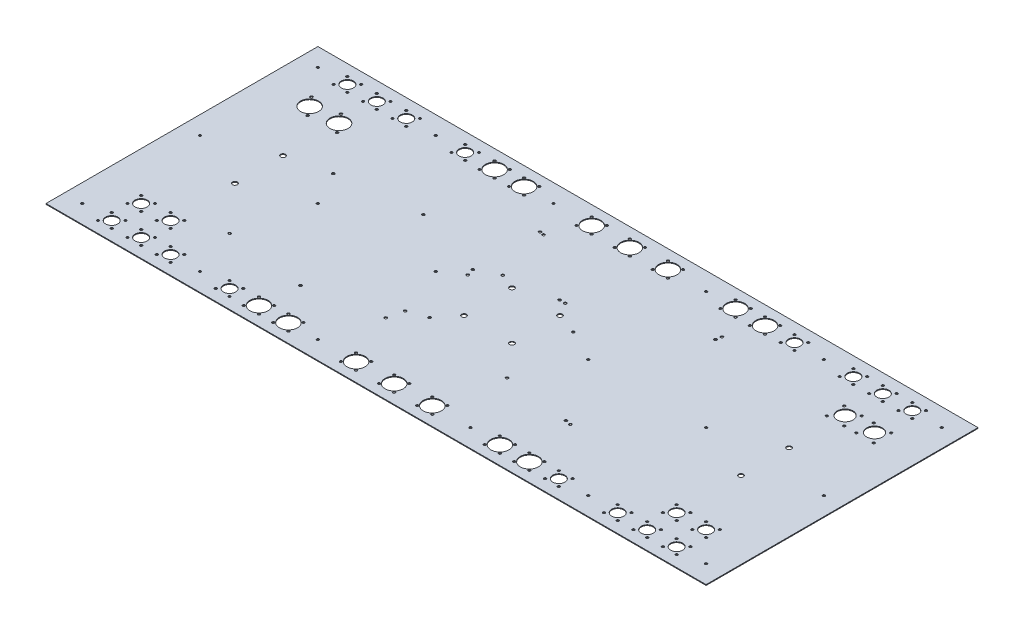
from build123d import *

# Parameters (mm, degrees)
MAIN_PLATE_W        = 874
MAIN_PLATE_H        = 360
BOSS_EXTRUDE1_DEPTH = 1.016
MAIN_HOLES_R        = 1.6
MAIN_HOLES_R_2      = 3.175
CUT_EXTRUDE1_DEPTH  = 473.620389167
FAN_R               = 1.6
FAN_R_2             = 12
CUT_EXTRUDE2_DEPTH  = 474.008271082
NTYPE_R             = 8
NTYPE_R_2           = 1.6
CUT_EXTRUDE3_DEPTH  = 473.620389167
ETHERNET_R          = 12
ETHERNET_R_2        = 1.755
CUT_EXTRUDE6_DEPTH  = 10
POWER_R             = 10.4521
POWER_R_2           = 1.5875
CUT_EXTRUDE7_DEPTH  = 10
ADS9_EVAL_R         = 1.75
CUT_EXTRUDE8_DEPTH  = 10


with BuildPart() as part:
    # main_plate → Boss-Extrude1 (new body)
    with BuildSketch(Plane(origin=(0, 0, 0), x_dir=(1, 0, 0), z_dir=(0, 1, 0))):
        Rectangle(MAIN_PLATE_W, MAIN_PLATE_H)
    extrude(amount=BOSS_EXTRUDE1_DEPTH)

    # main_holes → Cut-Extrude1 (cut, through all)
    with BuildSketch(Plane(origin=(0, 1.016, 0), x_dir=(1, 0, 0), z_dir=(0, 1, 0))):
        with Locations((-413, 156)):
            Circle(MAIN_HOLES_R)
        with Locations((-335, 31.805896398)):
            Circle(MAIN_HOLES_R_2)
        with Locations((-335, -31.805896398)):
            Circle(MAIN_HOLES_R_2)
        with Locations((-257, 156)):
            Circle(MAIN_HOLES_R)
        with Locations((-101, 156)):
            Circle(MAIN_HOLES_R)
        with Locations((-257, 0)):
            Circle(MAIN_HOLES_R)
        with Locations((-101, 0)):
            Circle(MAIN_HOLES_R)
        with Locations((-257, -156)):
            Circle(MAIN_HOLES_R)
        with Locations((-101, -156)):
            Circle(MAIN_HOLES_R)
        with Locations((-413, 0)):
            Circle(MAIN_HOLES_R)
        with Locations((-413, -156)):
            Circle(MAIN_HOLES_R)
        with Locations((-31.75, 31.75)):
            Circle(MAIN_HOLES_R_2)
        with Locations((-31.75, -31.75)):
            Circle(MAIN_HOLES_R_2)
        with Locations((31.75, -31.75)):
            Circle(MAIN_HOLES_R_2)
        with Locations((31.75, 31.75)):
            Circle(MAIN_HOLES_R_2)
        with Locations((413, -156)):
            Circle(MAIN_HOLES_R)
        with Locations((413, 0)):
            Circle(MAIN_HOLES_R)
        with Locations((101, -156)):
            Circle(MAIN_HOLES_R)
        with Locations((257, -156)):
            Circle(MAIN_HOLES_R)
        with Locations((101, 0)):
            Circle(MAIN_HOLES_R)
        with Locations((257, 0)):
            Circle(MAIN_HOLES_R)
        with Locations((101, 156)):
            Circle(MAIN_HOLES_R)
        with Locations((257, 156)):
            Circle(MAIN_HOLES_R)
        with Locations((335, -31.805896398)):
            Circle(MAIN_HOLES_R_2)
        with Locations((335, 31.805896398)):
            Circle(MAIN_HOLES_R_2)
        with Locations((413, 156)):
            Circle(MAIN_HOLES_R)
    extrude(amount=-CUT_EXTRUDE1_DEPTH, mode=Mode.SUBTRACT)

    # fan → Cut-Extrude2 (cut, through all)
    with BuildSketch(Plane(origin=(0, 1.016, 1.016), x_dir=(1, 0, 0), z_dir=(0, 1, 0))):
        with Locations((130, -144.984)):
            Circle(FAN_R)
        with Locations((150, -144.984)):
            Circle(FAN_R)
        with Locations((150, -164.984)):
            Circle(FAN_R)
        with Locations((130, -164.984)):
            Circle(FAN_R)
        with Locations((140, -154.984)):
            Circle(FAN_R_2)
        with Locations((169, -144.984)):
            Circle(FAN_R)
        with Locations((189, -144.984)):
            Circle(FAN_R)
        with Locations((189, -164.984)):
            Circle(FAN_R)
        with Locations((169, -164.984)):
            Circle(FAN_R)
        with Locations((179, -154.984)):
            Circle(FAN_R_2)
        with Locations((-10, -144.984)):
            Circle(FAN_R)
        with Locations((10, -144.984)):
            Circle(FAN_R)
        with Locations((10, -164.984)):
            Circle(FAN_R)
        with Locations((-10, -164.984)):
            Circle(FAN_R)
        with Locations((0, -154.984)):
            Circle(FAN_R_2)
        with Locations((-60.5, -144.984)):
            Circle(FAN_R)
        with Locations((-40.5, -144.984)):
            Circle(FAN_R)
        with Locations((-40.5, -164.984)):
            Circle(FAN_R)
        with Locations((-60.5, -164.984)):
            Circle(FAN_R)
        with Locations((-50.5, -154.984)):
            Circle(FAN_R_2)
        with Locations((40.5, -144.984)):
            Circle(FAN_R)
        with Locations((60.5, -144.984)):
            Circle(FAN_R)
        with Locations((60.5, -164.984)):
            Circle(FAN_R)
        with Locations((40.5, -164.984)):
            Circle(FAN_R)
        with Locations((50.5, -154.984)):
            Circle(FAN_R_2)
        with Locations((-10, 167.016)):
            Circle(FAN_R)
        with Locations((10, 167.016)):
            Circle(FAN_R)
        with Locations((10, 147.016)):
            Circle(FAN_R)
        with Locations((-10, 147.016)):
            Circle(FAN_R)
        with Locations((0, 157.016)):
            Circle(FAN_R_2)
        with Locations((-60.5, 167.016)):
            Circle(FAN_R)
        with Locations((-40.5, 167.016)):
            Circle(FAN_R)
        with Locations((-40.5, 147.016)):
            Circle(FAN_R)
        with Locations((-60.5, 147.016)):
            Circle(FAN_R)
        with Locations((-50.5, 157.016)):
            Circle(FAN_R_2)
        with Locations((40.5, 167.016)):
            Circle(FAN_R)
        with Locations((60.5, 167.016)):
            Circle(FAN_R)
        with Locations((60.5, 147.016)):
            Circle(FAN_R)
        with Locations((40.5, 147.016)):
            Circle(FAN_R)
        with Locations((50.5, 157.016)):
            Circle(FAN_R_2)
        with Locations((-189, -144.984)):
            Circle(FAN_R)
        with Locations((-169, -144.984)):
            Circle(FAN_R)
        with Locations((-169, -164.984)):
            Circle(FAN_R)
        with Locations((-189, -164.984)):
            Circle(FAN_R)
        with Locations((-179, -154.984)):
            Circle(FAN_R_2)
        with Locations((-150, -144.984)):
            Circle(FAN_R)
        with Locations((-130, -144.984)):
            Circle(FAN_R)
        with Locations((-130, -164.984)):
            Circle(FAN_R)
        with Locations((-150, -164.984)):
            Circle(FAN_R)
        with Locations((-140, -154.984)):
            Circle(FAN_R_2)
        with Locations((-189, 167.016)):
            Circle(FAN_R)
        with Locations((-169, 167.016)):
            Circle(FAN_R)
        with Locations((-169, 147.016)):
            Circle(FAN_R)
        with Locations((-189, 147.016)):
            Circle(FAN_R)
        with Locations((-179, 157.016)):
            Circle(FAN_R_2)
        with Locations((-150, 167.016)):
            Circle(FAN_R)
        with Locations((-130, 167.016)):
            Circle(FAN_R)
        with Locations((-130, 147.016)):
            Circle(FAN_R)
        with Locations((-150, 147.016)):
            Circle(FAN_R)
        with Locations((-140, 157.016)):
            Circle(FAN_R_2)
        with Locations((130, 167.016)):
            Circle(FAN_R)
        with Locations((150, 167.016)):
            Circle(FAN_R)
        with Locations((150, 147.016)):
            Circle(FAN_R)
        with Locations((130, 147.016)):
            Circle(FAN_R)
        with Locations((140, 157.016)):
            Circle(FAN_R_2)
        with Locations((169, 167.016)):
            Circle(FAN_R)
        with Locations((189, 167.016)):
            Circle(FAN_R)
        with Locations((189, 147.016)):
            Circle(FAN_R)
        with Locations((169, 147.016)):
            Circle(FAN_R)
        with Locations((179, 157.016)):
            Circle(FAN_R_2)
    extrude(amount=-CUT_EXTRUDE2_DEPTH, mode=Mode.SUBTRACT)

    # ntype → Cut-Extrude3 (cut, through all)
    with BuildSketch(Plane(origin=(0, 1.016, 0), x_dir=(1, 0, 0), z_dir=(0, 1, 0))):
        with Locations((-218, 156)):
            Circle(NTYPE_R)
        with Locations((-227.1, 165.1)):
            Circle(NTYPE_R_2)
        with Locations((-208.9, 165.1)):
            Circle(NTYPE_R_2)
        with Locations((-208.9, 146.9)):
            Circle(NTYPE_R_2)
        with Locations((-227.1, 146.9)):
            Circle(NTYPE_R_2)
        with Locations((218, 156)):
            Circle(NTYPE_R)
        with Locations((208.9, 165.1)):
            Circle(NTYPE_R_2)
        with Locations((227.1, 165.1)):
            Circle(NTYPE_R_2)
        with Locations((227.1, 146.9)):
            Circle(NTYPE_R_2)
        with Locations((208.9, 146.9)):
            Circle(NTYPE_R_2)
        with Locations((-218, -156)):
            Circle(NTYPE_R)
        with Locations((-227.1, -146.9)):
            Circle(NTYPE_R_2)
        with Locations((-208.9, -146.9)):
            Circle(NTYPE_R_2)
        with Locations((-208.9, -165.1)):
            Circle(NTYPE_R_2)
        with Locations((-227.1, -165.1)):
            Circle(NTYPE_R_2)
        with Locations((218, -156)):
            Circle(NTYPE_R)
        with Locations((208.9, -146.9)):
            Circle(NTYPE_R_2)
        with Locations((227.1, -146.9)):
            Circle(NTYPE_R_2)
        with Locations((227.1, -165.1)):
            Circle(NTYPE_R_2)
        with Locations((208.9, -165.1)):
            Circle(NTYPE_R_2)
        with Locations((-374, 156)):
            Circle(NTYPE_R)
        with Locations((-383.1, 165.1)):
            Circle(NTYPE_R_2)
        with Locations((-364.9, 165.1)):
            Circle(NTYPE_R_2)
        with Locations((-364.9, 146.9)):
            Circle(NTYPE_R_2)
        with Locations((-383.1, 146.9)):
            Circle(NTYPE_R_2)
        with Locations((-296, 156)):
            Circle(NTYPE_R)
        with Locations((-305.1, 165.1)):
            Circle(NTYPE_R_2)
        with Locations((-286.9, 165.1)):
            Circle(NTYPE_R_2)
        with Locations((-286.9, 146.9)):
            Circle(NTYPE_R_2)
        with Locations((-305.1, 146.9)):
            Circle(NTYPE_R_2)
        with Locations((-335, 156)):
            Circle(NTYPE_R)
        with Locations((-344.1, 165.1)):
            Circle(NTYPE_R_2)
        with Locations((-325.9, 165.1)):
            Circle(NTYPE_R_2)
        with Locations((-325.9, 146.9)):
            Circle(NTYPE_R_2)
        with Locations((-344.1, 146.9)):
            Circle(NTYPE_R_2)
        with Locations((296, -156)):
            Circle(NTYPE_R)
        with Locations((286.9, -146.9)):
            Circle(NTYPE_R_2)
        with Locations((305.1, -146.9)):
            Circle(NTYPE_R_2)
        with Locations((305.1, -165.1)):
            Circle(NTYPE_R_2)
        with Locations((286.9, -165.1)):
            Circle(NTYPE_R_2)
        with Locations((374, -156)):
            Circle(NTYPE_R)
        with Locations((364.9, -146.9)):
            Circle(NTYPE_R_2)
        with Locations((383.1, -146.9)):
            Circle(NTYPE_R_2)
        with Locations((383.1, -165.1)):
            Circle(NTYPE_R_2)
        with Locations((364.9, -165.1)):
            Circle(NTYPE_R_2)
        with Locations((335, -156)):
            Circle(NTYPE_R)
        with Locations((325.9, -146.9)):
            Circle(NTYPE_R_2)
        with Locations((344.1, -146.9)):
            Circle(NTYPE_R_2)
        with Locations((344.1, -165.1)):
            Circle(NTYPE_R_2)
        with Locations((325.9, -165.1)):
            Circle(NTYPE_R_2)
        with Locations((296, 156)):
            Circle(NTYPE_R)
        with Locations((286.9, 165.1)):
            Circle(NTYPE_R_2)
        with Locations((305.1, 165.1)):
            Circle(NTYPE_R_2)
        with Locations((305.1, 146.9)):
            Circle(NTYPE_R_2)
        with Locations((286.9, 146.9)):
            Circle(NTYPE_R_2)
        with Locations((374, 156)):
            Circle(NTYPE_R)
        with Locations((364.9, 165.1)):
            Circle(NTYPE_R_2)
        with Locations((383.1, 165.1)):
            Circle(NTYPE_R_2)
        with Locations((383.1, 146.9)):
            Circle(NTYPE_R_2)
        with Locations((364.9, 146.9)):
            Circle(NTYPE_R_2)
        with Locations((335, 156)):
            Circle(NTYPE_R)
        with Locations((325.9, 165.1)):
            Circle(NTYPE_R_2)
        with Locations((344.1, 165.1)):
            Circle(NTYPE_R_2)
        with Locations((344.1, 146.9)):
            Circle(NTYPE_R_2)
        with Locations((325.9, 146.9)):
            Circle(NTYPE_R_2)
        with Locations((-374, -156)):
            Circle(NTYPE_R)
        with Locations((-383.1, -146.9)):
            Circle(NTYPE_R_2)
        with Locations((-364.9, -146.9)):
            Circle(NTYPE_R_2)
        with Locations((-364.9, -165.1)):
            Circle(NTYPE_R_2)
        with Locations((-383.1, -165.1)):
            Circle(NTYPE_R_2)
        with Locations((-296, -156)):
            Circle(NTYPE_R)
        with Locations((-305.1, -146.9)):
            Circle(NTYPE_R_2)
        with Locations((-286.9, -146.9)):
            Circle(NTYPE_R_2)
        with Locations((-286.9, -165.1)):
            Circle(NTYPE_R_2)
        with Locations((-305.1, -165.1)):
            Circle(NTYPE_R_2)
        with Locations((-335, -156)):
            Circle(NTYPE_R)
        with Locations((-344.1, -146.9)):
            Circle(NTYPE_R_2)
        with Locations((-325.9, -146.9)):
            Circle(NTYPE_R_2)
        with Locations((-325.9, -165.1)):
            Circle(NTYPE_R_2)
        with Locations((-344.1, -165.1)):
            Circle(NTYPE_R_2)
        with Locations((-335, -117)):
            Circle(NTYPE_R)
        with Locations((-344.1, -107.9)):
            Circle(NTYPE_R_2)
        with Locations((-325.9, -107.9)):
            Circle(NTYPE_R_2)
        with Locations((-325.9, -126.1)):
            Circle(NTYPE_R_2)
        with Locations((-344.1, -126.1)):
            Circle(NTYPE_R_2)
        with Locations((-374, -117)):
            Circle(NTYPE_R)
        with Locations((-383.1, -107.9)):
            Circle(NTYPE_R_2)
        with Locations((-364.9, -107.9)):
            Circle(NTYPE_R_2)
        with Locations((-364.9, -126.1)):
            Circle(NTYPE_R_2)
        with Locations((-383.1, -126.1)):
            Circle(NTYPE_R_2)
        with Locations((374, -117)):
            Circle(NTYPE_R)
        with Locations((364.9, -107.9)):
            Circle(NTYPE_R_2)
        with Locations((383.1, -107.9)):
            Circle(NTYPE_R_2)
        with Locations((383.1, -126.1)):
            Circle(NTYPE_R_2)
        with Locations((364.9, -126.1)):
            Circle(NTYPE_R_2)
        with Locations((335, -117)):
            Circle(NTYPE_R)
        with Locations((325.9, -107.9)):
            Circle(NTYPE_R_2)
        with Locations((344.1, -107.9)):
            Circle(NTYPE_R_2)
        with Locations((344.1, -126.1)):
            Circle(NTYPE_R_2)
        with Locations((325.9, -126.1)):
            Circle(NTYPE_R_2)
    extrude(amount=-CUT_EXTRUDE3_DEPTH, mode=Mode.SUBTRACT)

    # ethernet → Cut-Extrude6 (cut)
    with BuildSketch(Plane(origin=(0, 1.016, 0), x_dir=(1, 0, 0), z_dir=(0, 1, 0))):
        with Locations((-374, 106)):
            Circle(ETHERNET_R)
        with Locations((-383.5, 118)):
            Circle(ETHERNET_R_2)
        with Locations((-364.5, 94)):
            Circle(ETHERNET_R_2)
        with Locations((-335, 106)):
            Circle(ETHERNET_R)
        with Locations((-344.5, 118)):
            Circle(ETHERNET_R_2)
        with Locations((-325.5, 94)):
            Circle(ETHERNET_R_2)
    extrude(amount=-CUT_EXTRUDE6_DEPTH, mode=Mode.SUBTRACT)

    # power → Cut-Extrude7 (cut)
    with BuildSketch(Plane(origin=(0, 1.016, 0), x_dir=(1, 0, 0), z_dir=(0, 1, 0))):
        with Locations((374, 106)):
            Circle(POWER_R)
        with Locations((362.4938, 116.4521)):
            Circle(POWER_R_2)
        with Locations((385.5062, 116.4521)):
            Circle(POWER_R_2)
        with Locations((385.5062, 93.4397)):
            Circle(POWER_R_2)
        with Locations((362.4938, 93.4397)):
            Circle(POWER_R_2)
        with Locations((335, 106)):
            Circle(POWER_R)
        with Locations((323.4938, 116.4521)):
            Circle(POWER_R_2)
        with Locations((346.5062, 116.4521)):
            Circle(POWER_R_2)
        with Locations((346.5062, 93.4397)):
            Circle(POWER_R_2)
        with Locations((323.4938, 93.4397)):
            Circle(POWER_R_2)
    extrude(amount=-CUT_EXTRUDE7_DEPTH, mode=Mode.SUBTRACT)

    # ads9+eval → Cut-Extrude8 (cut)
    with BuildSketch(Plane(origin=(0, 1.016, -2.032), x_dir=(-1, 0, 0), z_dir=(0, 1, 0))):
        with Locations((-163.448203992, 88.203560801)):
            Circle(ADS9_EVAL_R)
        with Locations((-156.208203992, 86.883560801)):
            Circle(ADS9_EVAL_R)
        with Locations((-162.188203992, -105.276439199)):
            Circle(ADS9_EVAL_R)
        with Locations((-163.458203992, -112.456439199)):
            Circle(ADS9_EVAL_R)
        with Locations((-21.218203992, -47.366439199)):
            Circle(ADS9_EVAL_R)
        with Locations((-13.598203992, -47.366439199)):
            Circle(ADS9_EVAL_R)
        with Locations((52.261796008, -38.116439199)):
            Circle(ADS9_EVAL_R)
        with Locations((-59.498203992, -19.736439199)):
            Circle(ADS9_EVAL_R)
        with Locations((78.651796008, -24.826439199)):
            Circle(ADS9_EVAL_R)
        with Locations((75.941796008, -15.356439199)):
            Circle(ADS9_EVAL_R)
        with Locations((71.741796008, -111.496439199)):
            Circle(ADS9_EVAL_R)
        with Locations((77.384232907, -112.456439199)):
            Circle(ADS9_EVAL_R)
        with Locations((52.271796008, 58.913560801)):
            Circle(ADS9_EVAL_R)
        with Locations((76.101796008, 67.443560801)):
            Circle(ADS9_EVAL_R)
        with Locations((81.021796008, 88.203560801)):
            Circle(ADS9_EVAL_R)
        with Locations((-68.198203992, 76.813560801)):
            Circle(ADS9_EVAL_R)
        with Locations((174.471443194, 107.549678721)):
            Circle(ADS9_EVAL_R)
        with Locations((281.151443194, 94.792445134)):
            Circle(ADS9_EVAL_R)
        with Locations((281.077859514, -42.367535128)):
            Circle(ADS9_EVAL_R)
        with Locations((174.384232907, -55.010297885)):
            Circle(ADS9_EVAL_R)
    extrude(amount=-CUT_EXTRUDE8_DEPTH, mode=Mode.SUBTRACT)


solid = part.part
